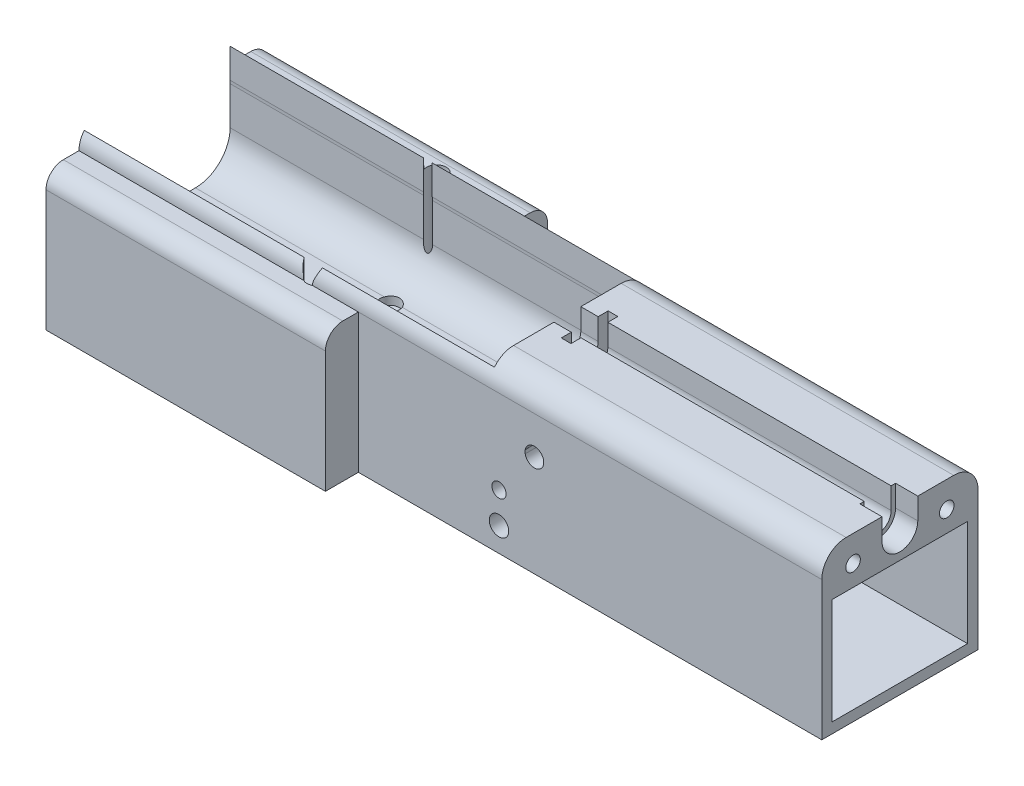
from build123d import *

# Parameters (mm, degrees)
SKETCH1_W           = 223
SKETCH1_H           = 45
BOSS_EXTRUDE1_DEPTH = 42
SKETCH4_W           = 7.75
SKETCH4_H           = 6.175
CUT_EXTRUDE14_DEPTH = 95.8
SKETCH5_R           = 3.875
CUT_EXTRUDE15_DEPTH = 95.8
SKETCH7_W           = 118.2
SKETCH7_H           = 42
CUT_EXTRUDE17_DEPTH = 21
SKETCH11_W          = 2.8
SKETCH11_H          = 13.5
CUT_EXTRUDE19_DEPTH = 11.5
BOSS_EXTRUDE2_DEPTH = 5
SKETCH42_W          = 80.5
SKETCH42_H          = 9.5
BOSS_EXTRUDE3_DEPTH = 35
SKETCH38_R          = 3.1
CUT_EXTRUDE32_DEPTH = 4.7
SKETCH41_R          = 5.75
CUT_EXTRUDE35_DEPTH = 4
FILLET1_R           = 7
FILLET7_R           = 5
SKETCH47_R          = 1.5
CUT_EXTRUDE39_DEPTH = 7
SKETCH49_R          = 2.8
CUT_EXTRUDE41_DEPTH = 33
CUT_EXTRUDE43_DEPTH = 6.4
SKETCH53_R          = 2.1
CUT_EXTRUDE44_DEPTH = 95
SKETCH55_W          = 39
SKETCH55_H          = 30.52
CUT_EXTRUDE46_DEPTH = 55
SKETCH56_W          = 15.8
SKETCH56_H          = 10.4
CUT_EXTRUDE47_DEPTH = 32.15
SKETCH57_W          = 5
SKETCH57_H          = 10.4
CUT_EXTRUDE48_DEPTH = 15
SKETCH58_R          = 2.8
SKETCH58_R_2        = 2.05
CUT_EXTRUDE49_DEPTH = 10
SKETCH59_R          = 1.5
SKETCH59_R_2        = 0.95
CUT_EXTRUDE50_DEPTH = 6.5
CUT_EXTRUDE51_START = -9
CUT_EXTRUDE51_DEPTH = 9
CUT_EXTRUDE52_DEPTH = 118.2
SKETCH64_R          = 1.5
CUT_EXTRUDE53_DEPTH = 14
SKETCH65_R          = 2.8
CUT_EXTRUDE54_DEPTH = 9.95
SKETCH66_R          = 1.5
CUT_EXTRUDE55_DEPTH = 25
SKETCH67_R          = 1.45
CUT_EXTRUDE56_DEPTH = 7
SKETCH68_R          = 2.6
CUT_EXTRUDE57_DEPTH = 28.3
SKETCH70_R          = 5.5
CUT_EXTRUDE59_DEPTH = 8
CUT_EXTRUDE60_START = 4
SKETCH71_R          = 2.8
CUT_EXTRUDE60_DEPTH = 42


with BuildPart() as part:
    # Sketch1 → Boss-Extrude1 (new body)
    with BuildSketch(Plane(origin=(0, 0, 0), x_dir=(1, 0, 0), z_dir=(0, 1, 0))):
        with Locations((111.5, 22.5)):
            Rectangle(SKETCH1_W, SKETCH1_H)
    extrude(amount=BOSS_EXTRUDE1_DEPTH)

    # Sketch4 → Cut-Extrude14 (cut)
    with BuildSketch(Plane(origin=(223, 0, 0), x_dir=(0, 0, -1), z_dir=(1, 0, 0))):
        with Locations((22.5, 38.9125)):
            Rectangle(SKETCH4_W, SKETCH4_H)
    extrude(amount=-CUT_EXTRUDE14_DEPTH, mode=Mode.SUBTRACT)

    # Sketch5 → Cut-Extrude15 (cut)
    with BuildSketch(Plane(origin=(223, 0, 0), x_dir=(0, 0, -1), z_dir=(1, 0, 0))):
        with Locations((22.5, 35.825)):
            Circle(SKETCH5_R)
    extrude(amount=-CUT_EXTRUDE15_DEPTH, mode=Mode.SUBTRACT)

    # Sketch7 → Cut-Extrude17 (cut)
    with BuildSketch(Plane(origin=(0, 42, 0), x_dir=(1, 0, 0), z_dir=(0, 1, 0))):
        with Locations((68.1, 22.5)):
            Rectangle(SKETCH7_W, SKETCH7_H)
    extrude(amount=-CUT_EXTRUDE17_DEPTH, mode=Mode.SUBTRACT)

    # Sketch11 → Cut-Extrude19 (cut)
    with BuildSketch(Plane(origin=(0, 42, 0), x_dir=(1, 0, 0), z_dir=(0, 1, 0))):
        with Locations((133.6, 22.5)):
            Rectangle(SKETCH11_W, SKETCH11_H)
    extrude(amount=-CUT_EXTRUDE19_DEPTH, mode=Mode.SUBTRACT)

    # Sketch14 → Boss-Extrude2 (add)
    with BuildSketch(Plane.XZ):
        Polygon((9, -54.5), (89.5, -54.5), (89.5, -45), (223, -45), (223, 0), (89.5, 0), (89.5, 9.5), (9, 9.5), (9, 0), (0, 0), (0, -45), (9, -45), align=None)
    extrude(amount=BOSS_EXTRUDE2_DEPTH)

    # Sketch42 → Boss-Extrude3 (add)
    with BuildSketch(Plane(origin=(0, 0, 0), x_dir=(1, 0, 0), z_dir=(0, 1, 0))):
        with Locations((49.25, -4.75)):
            Rectangle(SKETCH42_W, SKETCH42_H)
        with Locations((49.25, 49.75)):
            Rectangle(SKETCH42_W, SKETCH42_H)
    extrude(amount=BOSS_EXTRUDE3_DEPTH)

    # Sketch38 → Cut-Extrude32 (cut)
    with BuildSketch(Plane(origin=(127.2, -5, -22.5), x_dir=(0, 0, -1), z_dir=(0, -1, 0))):
        with Locations((23.5, -61.2)):
            Circle(SKETCH38_R)
        with Locations((10, -61.2)):
            Circle(SKETCH38_R)
    extrude(amount=-CUT_EXTRUDE32_DEPTH, mode=Mode.SUBTRACT)

    # Sketch41 → Cut-Extrude35 (cut)
    with BuildSketch(Plane(origin=(127.2, -5, -22.5), x_dir=(0, 0, -1), z_dir=(0, -1, 0))):
        with Locations((20, -73.2)):
            Circle(SKETCH41_R)
        with Locations((-20, -73.2)):
            Circle(SKETCH41_R)
    extrude(amount=-CUT_EXTRUDE35_DEPTH, mode=Mode.SUBTRACT)

    # Fillet1
    # the kernel refuses this fillet: 7 mm, written as the material it takes off along each edge
    with BuildSketch(Plane(origin=(240.5, 42, -45), x_dir=(0, 0, 1), z_dir=(-1, 0, 0))) as fillet1_piece_1:
        with BuildLine():
            CenterArc((FILLET1_R, -FILLET1_R), FILLET1_R, 90, 90)
            Line((0, -FILLET1_R), (0, 0))
            Line((0, 0), (FILLET1_R, 0))
        make_face()
    extrude(amount=258, mode=Mode.SUBTRACT)
    with BuildSketch(Plane(origin=(-17.5, 42, 0), x_dir=(0, -1, 0), z_dir=(1, 0, 0))) as fillet1_piece_2:
        with BuildLine():
            CenterArc((FILLET1_R, FILLET1_R), FILLET1_R, 180, 90)
            Line((0, FILLET1_R), (0, 0))
            Line((0, 0), (FILLET1_R, 0))
        make_face()
    extrude(amount=258, mode=Mode.SUBTRACT)

    # Fillet7
    fillet7_edges = [part.edges().sort_by_distance(p)[0] for p in [
        (49.25, 35, -54.5),
        (49.25, 35, 9.5),
    ]]
    fillet(fillet7_edges, radius=FILLET7_R)

    # Sketch47 → Cut-Extrude39 (cut)
    with BuildSketch(Plane(origin=(127.2, -0.3, -22.5), x_dir=(0, 0, -1), z_dir=(0, -1, 0))):
        with Locations((23.5, -61.2)):
            Circle(SKETCH47_R)
        with Locations((10, -61.2)):
            Circle(SKETCH47_R)
    extrude(amount=-CUT_EXTRUDE39_DEPTH, mode=Mode.SUBTRACT)

    # Sketch49 → Cut-Extrude41 (cut)
    with BuildSketch(Plane.XZ.offset(-6.7)):
        with Locations(Location((66, -32.5, 0), (0, 0, 270))):
            Circle(SKETCH49_R)
        with Locations(Location((66, -46, 0), (0, 0, 270))):
            Circle(SKETCH49_R)
    extrude(amount=-CUT_EXTRUDE41_DEPTH, mode=Mode.SUBTRACT)

    # Sketch52 → Cut-Extrude43 (cut)
    with BuildSketch(Plane(origin=(223, 0, 0), x_dir=(0, 0, -1), z_dir=(1, 0, 0))):
        with BuildLine():
            Line((17.35, 42), (17.35, 35.82))
            ThreePointArc((17.35, 35.82), (22.5, 30.67), (27.65, 35.82))
            Line((27.65, 35.82), (27.65, 42))
            Line((27.65, 42), (17.35, 42))
        make_face()
    extrude(amount=-CUT_EXTRUDE43_DEPTH, mode=Mode.SUBTRACT)

    # Sketch53 → Cut-Extrude44 (cut)
    with BuildSketch(Plane(origin=(223, 0, 0), x_dir=(0, 0, -1), z_dir=(1, 0, 0))):
        with Locations((9, 34.5)):
            Circle(SKETCH53_R)
        with Locations((36, 34.5)):
            Circle(SKETCH53_R)
    extrude(amount=-CUT_EXTRUDE44_DEPTH, mode=Mode.SUBTRACT)

    # Sketch55 → Cut-Extrude46 (cut)
    with BuildSketch(Plane(origin=(223, 0, 0), x_dir=(0, 0, -1), z_dir=(1, 0, 0))):
        with Locations((22.5, 13.26)):
            Rectangle(SKETCH55_W, SKETCH55_H)
    extrude(amount=-CUT_EXTRUDE46_DEPTH, mode=Mode.SUBTRACT)

    # Sketch56 → Cut-Extrude47 (cut)
    with BuildSketch(Plane.XZ.offset(5)):
        with Locations((135.1, -14.2)):
            Rectangle(SKETCH56_W, SKETCH56_H)
    extrude(amount=-CUT_EXTRUDE47_DEPTH, mode=Mode.SUBTRACT)

    # Sketch57 → Cut-Extrude48 (cut)
    with BuildSketch(Plane.XZ.offset(5)):
        with Locations((124.7, -14.2)):
            Rectangle(SKETCH57_W, SKETCH57_H)
    extrude(amount=-CUT_EXTRUDE48_DEPTH, mode=Mode.SUBTRACT)

    # Sketch58 → Cut-Extrude49 (cut)
    with BuildSketch(Plane(origin=(127.2, 21, 0), x_dir=(0, -1, 0), z_dir=(0, 0, 1))):
        with Locations(Location((19.05, 2.8, 0), (0, 0, 90))):
            Circle(SKETCH58_R)
        with Locations(Location((10.15, 2.8, 0), (0, 0, 90))):
            Circle(SKETCH58_R_2)
        with BuildLine():
            Line((-2.632795978, 15.65), (-3.667204022, 15.65))
            ThreePointArc((-3.667204022, 15.65), (-5.85, 13), (-3.667204022, 10.35))
            Line((-3.667204022, 10.35), (-2.632795978, 10.35))
            ThreePointArc((-2.632795978, 10.35), (-0.45, 13), (-2.632795978, 15.65))
        make_face()
    extrude(amount=-CUT_EXTRUDE49_DEPTH, mode=Mode.SUBTRACT)

    # Sketch59 → Cut-Extrude50 (cut)
    with BuildSketch(Plane.XY.offset(-19.4)):
        with Locations((130, 1.95)):
            Circle(SKETCH59_R)
        with Locations((130, 10.85)):
            Circle(SKETCH59_R_2)
        with Locations((140.2, 24.15)):
            Circle(SKETCH59_R)
    extrude(amount=-CUT_EXTRUDE50_DEPTH, mode=Mode.SUBTRACT)

    # Sketch62 → Cut-Extrude51 (cut)
    with BuildSketch(Plane.ZY.offset(CUT_EXTRUDE51_START)):
        with BuildLine():
            Line((0, -5), (-45, -5))
            Line((-45, -5), (-45, 35))
            ThreePointArc((-45, 35), (-42.949747468, 39.949747468), (-38, 42))
            Line((-38, 42), (-7, 42))
            ThreePointArc((-7, 42), (-2.050252532, 39.949747468), (0, 35))
            Line((0, 35), (0, -5))
        make_face()
    extrude(amount=CUT_EXTRUDE51_DEPTH, mode=Mode.SUBTRACT)

    # Sketch63 → Cut-Extrude52 (cut)
    with BuildSketch(Plane(origin=(127.2, 21, -22.5), x_dir=(0, 0, -1), z_dir=(-1, 0, 0))):
        with BuildLine():
            Line((-10.959716831, -18.950283169), (11.040283169, -18.950283169))
            ThreePointArc((11.040283169, -18.950283169), (18.111350981, -16.021350981), (21.040283169, -8.950283169))
            Line((21.040283169, -8.950283169), (21.040283169, 2.049716831))
            ThreePointArc((21.040283169, 2.049716831), (18.111350981, 9.120784643), (11.040283169, 12.049716831))
            Line((11.040283169, 12.049716831), (-10.959716831, 12.049716831))
            ThreePointArc((-10.959716831, 12.049716831), (-18.030784643, 9.120784643), (-20.959716831, 2.049716831))
            Line((-20.959716831, 2.049716831), (-20.959716831, -8.950283169))
            ThreePointArc((-20.959716831, -8.950283169), (-18.030784643, -16.021350981), (-10.959716831, -18.950283169))
        make_face()
    extrude(amount=CUT_EXTRUDE52_DEPTH, mode=Mode.SUBTRACT)

    # Sketch64 → Cut-Extrude53 (cut)
    with BuildSketch(Plane(origin=(127.2, -5, -22.5), x_dir=(0, 0, -1), z_dir=(0, -1, 0))):
        with Locations((-1, -71.2)):
            Circle(SKETCH64_R)
    extrude(amount=-CUT_EXTRUDE53_DEPTH, mode=Mode.SUBTRACT)

    # Sketch65 → Cut-Extrude54 (cut)
    with BuildSketch(Plane(origin=(127.2, 8.950283169, -22.5), x_dir=(0, 0, 1), z_dir=(0, 1, 0))):
        with Locations((1, -71.2)):
            Circle(SKETCH65_R)
    extrude(amount=-CUT_EXTRUDE54_DEPTH, mode=Mode.SUBTRACT)

    # Sketch66 → Cut-Extrude55 (cut)
    with BuildSketch(Plane(origin=(127.2, -5, -22.5), x_dir=(0, 0, -1), z_dir=(0, -1, 0))):
        with Locations((-20, -52.2)):
            Circle(SKETCH66_R)
    extrude(amount=-CUT_EXTRUDE55_DEPTH, mode=Mode.SUBTRACT)

    # Sketch67 → Cut-Extrude56 (cut)
    with BuildSketch(Plane(origin=(9, 21, -22.5), x_dir=(0, 0, -1), z_dir=(-1, 0, 0))):
        with Locations(Location((27, -9, 0), (0, 0, 180))):
            Circle(SKETCH67_R)
        with Locations(Location((27, 21, 0), (0, 0, 180))):
            Circle(SKETCH67_R)
        with Locations(Location((-27, 21, 0), (0, 0, 180))):
            Circle(SKETCH67_R)
        with Locations(Location((-27, -9, 0), (0, 0, 180))):
            Circle(SKETCH67_R)
    extrude(amount=-CUT_EXTRUDE56_DEPTH, mode=Mode.SUBTRACT)

    # Sketch68 → Cut-Extrude57 (cut)
    with BuildSketch(Plane.ZY.offset(-127.2)):
        with Locations((-9, 34.5)):
            Circle(SKETCH68_R)
        with Locations((-36, 34.5)):
            Circle(SKETCH68_R)
    extrude(amount=-CUT_EXTRUDE57_DEPTH, mode=Mode.SUBTRACT)

    # Sketch70 → Cut-Extrude59 (cut)
    with BuildSketch(Plane(origin=(127.2, -5, -22.5), x_dir=(0, 0, -1), z_dir=(0, -1, 0))):
        with Locations((0, -33.7)):
            Circle(SKETCH70_R)
    extrude(amount=-CUT_EXTRUDE59_DEPTH, mode=Mode.SUBTRACT)

    # Sketch71 → Cut-Extrude60 (cut)
    with BuildSketch(Plane(origin=(127.2, -5, -22.5), x_dir=(0, 0, 1), z_dir=(0, 1, 0)).offset(CUT_EXTRUDE60_START)):
        with Locations(Location((20, -52.2, 0), (0, 0, 69.955125611))):
            Circle(SKETCH71_R)
    extrude(amount=CUT_EXTRUDE60_DEPTH, mode=Mode.SUBTRACT)


solid = part.part
